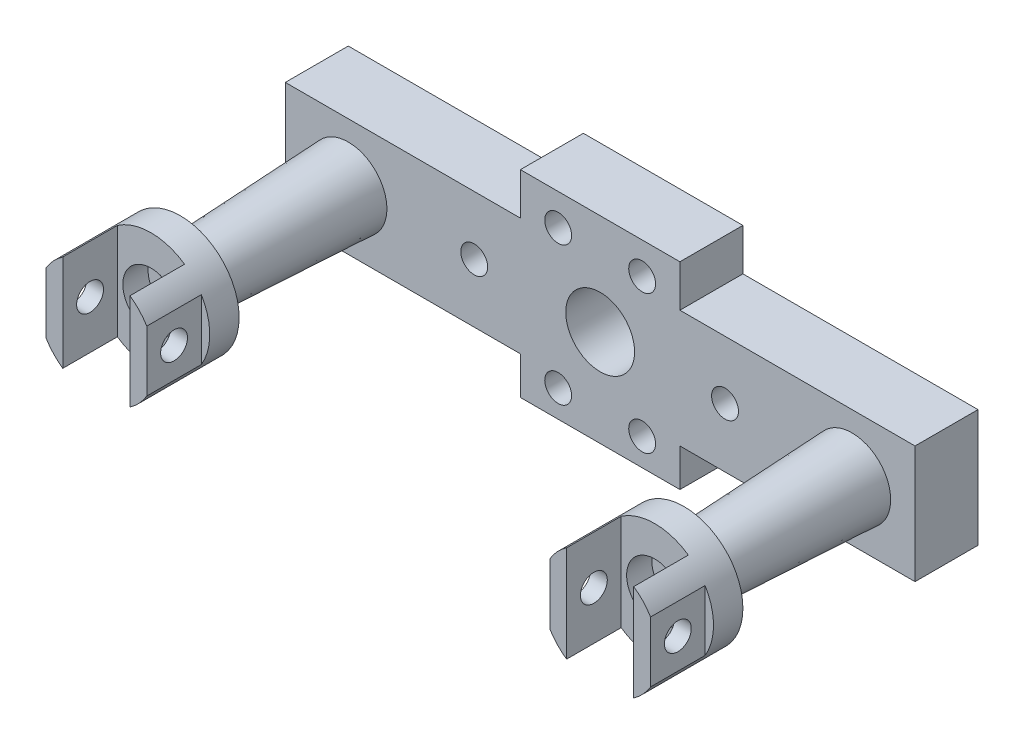
from build123d import *

# Parameters (mm, degrees)
SKETCH_1_R          = 4.1
SKETCH_1_R_2        = 1.6
EXTRUDE_1_DEPTH     = 7.5
CUT_EXTRUDE_1_DEPTH = 2.5
SKETCH_4_R          = 3.6
SKETCH_4_R_2        = 1.6
EXTRUDE_2_DEPTH     = 20
SKETCH_5_R          = 7
SKETCH_5_R_2        = 1.6
EXTRUDE_3_DEPTH     = 10
CUT_EXTRUDE_START   = -6.5
CUT_EXTRUDE_2_DEPTH = 6.5
SKETCH_7_R          = 1.6
CUT_EXTRUDE_3_DEPTH = 86.794813363
CHAMFER_1_SIZE      = 1
CHAMFER_1_SIZE_2    = 22
SKETCH_9_R          = 3.35
CUT_EXTRUDE_4_DEPTH = 3
SKETCH_11_R         = 3.35
CUT_EXTRUDE_5_DEPTH = 3


with BuildPart() as part:
    # 草图1 → 凸台-拉伸1 (new body)
    with BuildSketch(Plane.XY):
        Polygon((0, 11.5), (0, 4.5), (0.416202301, 4.5), (28, 4.5), (28, 0), (47, 0), (47, 4.5), (75, 4.5), (75, 18.5), (47, 18.5), (47, 23.5), (28, 23.5), (28, 18.5), (0, 18.5), align=None)
        with Locations((37.5, 11.5)):
            Circle(SKETCH_1_R, mode=Mode.SUBTRACT)
        with Locations((67.5, 11.5)):
            Circle(SKETCH_1_R_2, mode=Mode.SUBTRACT)
        with Locations((32.500024738, 3.227756818)):
            Circle(SKETCH_1_R_2, mode=Mode.SUBTRACT)
        with Locations((42.5, 3.25)):
            Circle(SKETCH_1_R_2, mode=Mode.SUBTRACT)
        with Locations((42.5, 19.75)):
            Circle(SKETCH_1_R_2, mode=Mode.SUBTRACT)
        with Locations((32.500024738, 19.75)):
            Circle(SKETCH_1_R_2, mode=Mode.SUBTRACT)
        with Locations((7.5, 11.5)):
            Circle(SKETCH_1_R_2, mode=Mode.SUBTRACT)
        with Locations((52.370486737, 11.554033831)):
            Circle(SKETCH_1_R_2, mode=Mode.SUBTRACT)
        with Locations((22.5, 11.5)):
            Circle(SKETCH_1_R_2, mode=Mode.SUBTRACT)
    extrude(amount=EXTRUDE_1_DEPTH)

    # 草图2 → 切除-拉伸1 (cut)
    with BuildSketch(Plane(origin=(0, 0, 0), x_dir=(-1, 0, 0), z_dir=(0, 0, -1))):
        Polygon((-38.862693304, 19.75), (-40.681346652, 22.9), (-44.318653348, 22.9), (-46.137306696, 19.75), (-44.318653348, 16.6), (-40.681346652, 16.6), align=None)
        Polygon((-28.862718042, 19.75), (-30.68137139, 22.9), (-34.318678086, 22.9), (-36.137331434, 19.75), (-34.318678086, 16.6), (-30.68137139, 16.6), align=None)
        Polygon((-38.862693304, 3.25), (-40.681346652, 6.4), (-44.318653348, 6.4), (-46.137306696, 3.25), (-44.318653348, 0.1), (-40.681346652, 0.1), align=None)
        Polygon((-28.862718042, 3.227756818), (-30.68137139, 6.377756818), (-34.318678086, 6.377756818), (-36.137331434, 3.227756818), (-34.318678086, 0.077756818), (-30.68137139, 0.077756818), align=None)
        Polygon((-63.862693304, 11.5), (-65.681346652, 14.65), (-69.318653348, 14.65), (-71.137306696, 11.5), (-69.318653348, 8.35), (-65.681346652, 8.35), align=None)
        Polygon((-3.862693304, 11.5), (-5.681346652, 14.65), (-9.318653348, 14.65), (-11.137306696, 11.5), (-9.318653348, 8.35), (-5.681346652, 8.35), align=None)
    extrude(amount=-CUT_EXTRUDE_1_DEPTH, mode=Mode.SUBTRACT)

    # 草图4 → 凸台-拉伸2 (add)
    # profile 1 of 2: a face of its own
    with BuildSketch(Plane.XY.offset(7.5)):
        with Locations(Location((7.5, 11.5, 0), (0, 0, 180))):
            Circle(SKETCH_4_R)
        with Locations(Location((7.5, 11.5, 0), (0, 0, 180))):
            Circle(SKETCH_4_R_2, mode=Mode.SUBTRACT)
    # profile 2 of 2: a face of its own
    with BuildSketch(Plane.XY.offset(7.5)):
        with Locations(Location((67.5, 11.5, 0), (0, 0, 180))):
            Circle(SKETCH_4_R)
        with Locations(Location((67.5, 11.5, 0), (0, 0, 180))):
            Circle(SKETCH_4_R_2, mode=Mode.SUBTRACT)
    extrude(amount=EXTRUDE_2_DEPTH)

    # 草图5 → 凸台-拉伸3 (add)
    # profile 1 of 2: a face of its own
    with BuildSketch(Plane.XY.offset(27.5)):
        with Locations((7.5, 11.5)):
            Circle(SKETCH_5_R)
        with Locations(Location((7.5, 11.5, 0), (0, 0, 180))):
            Circle(SKETCH_5_R_2, mode=Mode.SUBTRACT)
    # profile 2 of 2: a face of its own
    with BuildSketch(Plane.XY.offset(27.5)):
        with Locations((67.5, 11.5)):
            Circle(SKETCH_5_R)
        with Locations(Location((67.5, 11.5, 0), (0, 0, 180))):
            Circle(SKETCH_5_R_2, mode=Mode.SUBTRACT)
    extrude(amount=EXTRUDE_3_DEPTH)

    # 草图6 → 切除-拉伸2 (cut)
    with BuildSketch(Plane.XY.offset(37.5).offset(CUT_EXTRUDE_START)):
        with BuildLine():
            Line((1.5, 7.894448725), (1.5, 15.105551275))
            ThreePointArc((1.5, 15.105551275), (0.5, 11.5), (1.5, 7.894448725))
        make_face()
        with BuildLine():
            Line((73.5, 15.105551275), (73.5, 7.894448725))
            ThreePointArc((73.5, 7.894448725), (74.5, 11.5), (73.5, 15.105551275))
        make_face()
        with BuildLine():
            Line((3.5, 5.755437353), (3.5, 17.244562647))
            ThreePointArc((3.5, 17.244562647), (7.5, 18.5), (11.5, 17.244562647))
            Line((11.5, 17.244562647), (11.5, 5.755437353))
            ThreePointArc((11.5, 5.755437353), (7.5, 4.5), (3.5, 5.755437353))
        make_face()
        with BuildLine():
            Line((71.5, 7.894448725), (71.5, 17.244562647))
            ThreePointArc((71.5, 17.244562647), (67.5, 18.5), (63.5, 17.244562647))
            Line((63.5, 17.244562647), (63.5, 5.755437353))
            ThreePointArc((63.5, 5.755437353), (67.5, 4.5), (71.5, 5.755437353))
            Line((71.5, 5.755437353), (71.5, 7.894448725))
        make_face()
        with BuildLine():
            Line((13.5, 15.105551275), (13.5, 7.894448725))
            ThreePointArc((13.5, 7.894448725), (14.5, 11.5), (13.5, 15.105551275))
        make_face()
        with BuildLine():
            Line((61.5, 7.894448725), (61.5, 15.105551275))
            ThreePointArc((61.5, 15.105551275), (60.5, 11.5), (61.5, 7.894448725))
        make_face()
    extrude(amount=CUT_EXTRUDE_2_DEPTH, mode=Mode.SUBTRACT)

    # 草图7 → 切除-拉伸3 (cut, through all)
    with BuildSketch(Plane.ZY.offset(-1.5)):
        with Locations((34.25, 11.5)):
            Circle(SKETCH_7_R)
    extrude(amount=-CUT_EXTRUDE_3_DEPTH, mode=Mode.SUBTRACT)

    # 倒角1
    # the kernel refuses this chamfer: 22, 1 mm, written as the material it adds along each edge
    with BuildSketch(Plane(origin=(67.5, 11.5, 7.5), x_dir=(-1, 0, 0), z_dir=(0, 1, 0))) as chamfer_1_piece_1:
        Polygon((3.6 + CHAMFER_1_SIZE, 0), (3.6, CHAMFER_1_SIZE_2), (3.6, 0), align=None)
    revolve(axis=Axis((67.5, 11.5, 7.5), (0, 0, 1)))
    with BuildSketch(Plane(origin=(7.5, 11.5, 7.5), x_dir=(-1, 0, 0), z_dir=(0, 1, 0))) as chamfer_1_piece_2:
        Polygon((3.6 + CHAMFER_1_SIZE, 0), (3.6, CHAMFER_1_SIZE_2), (3.6, 0), align=None)
    revolve(axis=Axis((7.5, 11.5, 7.5), (0, 0, 1)))

    # 草图9 → 切除-拉伸4 (cut)
    with BuildSketch(Plane.XY.offset(31)):
        with Locations((7.5, 11.5)):
            Circle(SKETCH_9_R)
    extrude(amount=-CUT_EXTRUDE_4_DEPTH, mode=Mode.SUBTRACT)

    # 草图11 → 切除-拉伸5 (cut)
    with BuildSketch(Plane.XY.offset(31)):
        with Locations((67.5, 11.5)):
            Circle(SKETCH_11_R)
    extrude(amount=-CUT_EXTRUDE_5_DEPTH, mode=Mode.SUBTRACT)


solid = part.part
